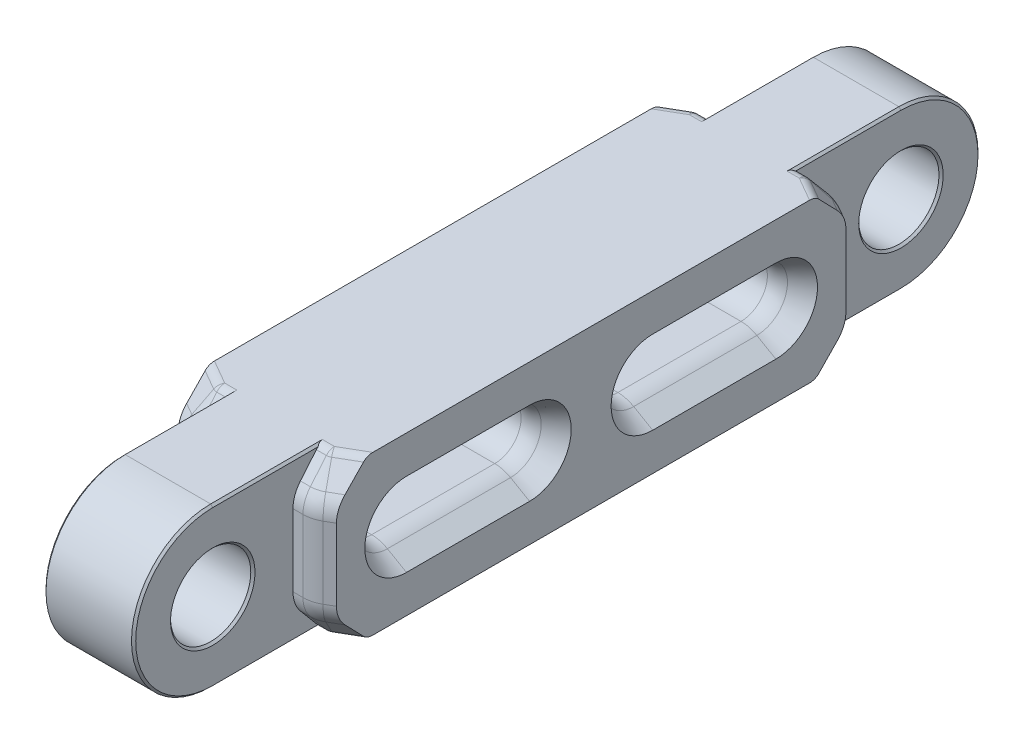
from build123d import *
from OCP.BRepFilletAPI import BRepFilletAPI_MakeChamfer

# Parameters (mm, degrees)
BOSS_EXTRUDE1_DEPTH = 8.5
BOSS_EXTRUDE2_DEPTH = 15
CHAMFER8_SIZE       = 3
CHAMFER8_SIZE2      = 1.732050808
FILLET6_R           = 6
CHAMFER9_SIZE       = 6
CHAMFER9_SIZE2      = 5.034597787
FILLET7_R           = 6
CHAMFER10_SIZE      = 5
CHAMFER10_SIZE2     = 2.886751346
FILLET8_R           = 6
FILLET9_R           = 2
CHAMFER11_SIZE      = 0.4


with BuildPart() as part:
    # Sketch1 → Boss-Extrude1 (new body)
    with BuildSketch(Plane.YZ):
        with BuildLine():
            ThreePointArc((0, -7.6), (-7.6, 0), (0, 7.6))
            Line((0, 7.6), (0, 15))
            ThreePointArc((0, 15), (-10.606601718, 10.606601718), (-15, 0))
            Line((-15, 0), (-15, -65.2))
            Line((-15, -65.2), (0, -65.2))
            Line((0, -65.2), (0, -58.533333333))
            ThreePointArc((0, -58.533333333), (-3.535533906, -57.068867239), (-5, -53.533333333))
            Line((-5, -53.533333333), (-5, -30.2))
            ThreePointArc((-5, -30.2), (-3.535533906, -26.664466094), (0, -25.2))
            Line((0, -25.2), (0, -7.6))
        make_face()
    extrude(amount=BOSS_EXTRUDE1_DEPTH)

    # Sketch1<4> → Boss-Extrude2 (add)
    with BuildSketch(Plane.YZ):
        with BuildLine():
            Line((0, -15.2), (-15, -15.2))
            Line((-15, -15.2), (-15, -65.2))
            Line((-15, -65.2), (0, -65.2))
            Line((0, -65.2), (0, -58.533333333))
            ThreePointArc((0, -58.533333333), (-3.535533906, -57.068867239), (-5, -53.533333333))
            Line((-5, -53.533333333), (-5, -30.2))
            ThreePointArc((-5, -30.2), (-3.535533906, -26.664466094), (0, -25.2))
            Line((0, -25.2), (0, -15.2))
        make_face()
    extrude(amount=BOSS_EXTRUDE2_DEPTH)

    # Chamfer8
    chamfer8_edges = [part.edges().sort_by_distance(p)[0] for p in [
        (15, -7.5, -15.2),
    ]]
    chamfer8_side = [part.faces().sort_by_distance(p)[0] for p in [
        (11.75, -7.5, -15.2),
    ]]
    chamfer(chamfer8_edges, length=CHAMFER8_SIZE, length2=CHAMFER8_SIZE2, reference=chamfer8_side[0])

    # Fillet6
    fillet6_edges = [part.edges().sort_by_distance(p)[0] for p in [
        (12, -7.5, -15.2),
    ]]
    fillet(fillet6_edges, radius=FILLET6_R)

    # Chamfer9: one chamfer whose edges measure the first distance from different faces: ONE call of the kernel's chamfer builder (chamfer() names one face for all edges)
    chamfer9_edges_1 = [part.edges().sort_by_distance(p)[0] for p in [
        (14.196152423, -15, -16.467949192),
    ]]
    chamfer9_side_1 = [part.faces().sort_by_distance(p)[0] for p in [
        (14.196152423, -7.5, -16.467949192),
    ]]
    chamfer9_edges_2 = [part.edges().sort_by_distance(p)[0] for p in [
        (11.945219116, -15, -15.404445042),
    ]]
    chamfer9_side_2 = [part.faces().sort_by_distance(p)[0] for p in [
        (11.945219116, -7.5, -15.404445042),
    ]]
    chamfer9_edges_3 = [part.edges().sort_by_distance(p)[0] for p in [
        (9.446152423, -15, -15.2),
    ]]
    chamfer9_side_3 = [part.faces().sort_by_distance(p)[0] for p in [
        (9.446152423, -7.5, -15.2),
    ]]
    chamfer9 = BRepFilletAPI_MakeChamfer(part.part.solid().wrapped)
    for e in chamfer9_edges_1:
        chamfer9.Add(CHAMFER9_SIZE, CHAMFER9_SIZE2, e.wrapped, chamfer9_side_1[0].wrapped)  # the first distance lies on this face
    for e in chamfer9_edges_2:
        chamfer9.Add(CHAMFER9_SIZE, CHAMFER9_SIZE2, e.wrapped, chamfer9_side_2[0].wrapped)  # the first distance lies on this face
    for e in chamfer9_edges_3:
        chamfer9.Add(CHAMFER9_SIZE, CHAMFER9_SIZE2, e.wrapped, chamfer9_side_3[0].wrapped)  # the first distance lies on this face
    add(Compound.cast(chamfer9.Shape()), mode=Mode.REPLACE)

    # Fillet7
    fillet7_edges = [part.edges().sort_by_distance(p)[0] for p in [
        (14.196152423, -9, -16.467949192),
        (11.945219116, -9, -15.404445042),
        (9.446152423, -9, -15.2),
    ]]
    fillet(fillet7_edges, radius=FILLET7_R)

    # Chamfer10: one chamfer whose edges measure the first distance from different faces: ONE call of the kernel's chamfer builder (chamfer() names one face for all edges)
    chamfer10_edges_1 = [part.edges().sort_by_distance(p)[0] for p in [
        (15, -3.535533906, -57.068867239),
    ]]
    chamfer10_side_1 = [part.faces().sort_by_distance(p)[0] for p in [
        (7.5, -3.535533906, -57.068867239),
    ]]
    chamfer10_edges_2 = [part.edges().sort_by_distance(p)[0] for p in [
        (15, -5, -41.866666667),
    ]]
    chamfer10_side_2 = [part.faces().sort_by_distance(p)[0] for p in [
        (7.5, -5, -41.866666667),
    ]]
    chamfer10_edges_3 = [part.edges().sort_by_distance(p)[0] for p in [
        (15, -3.535533906, -26.664466094),
    ]]
    chamfer10_side_3 = [part.faces().sort_by_distance(p)[0] for p in [
        (7.5, -3.535533906, -26.664466094),
    ]]
    chamfer10 = BRepFilletAPI_MakeChamfer(part.part.solid().wrapped)
    for e in chamfer10_edges_1:
        chamfer10.Add(CHAMFER10_SIZE, CHAMFER10_SIZE2, e.wrapped, chamfer10_side_1[0].wrapped)  # the first distance lies on this face
    for e in chamfer10_edges_2:
        chamfer10.Add(CHAMFER10_SIZE, CHAMFER10_SIZE2, e.wrapped, chamfer10_side_2[0].wrapped)  # the first distance lies on this face
    for e in chamfer10_edges_3:
        chamfer10.Add(CHAMFER10_SIZE, CHAMFER10_SIZE2, e.wrapped, chamfer10_side_3[0].wrapped)  # the first distance lies on this face
    add(Compound.cast(chamfer10.Shape()), mode=Mode.REPLACE)

    # Fillet8
    fillet8_edges = [part.edges().sort_by_distance(p)[0] for p in [
        (10, -3.535533906, -57.068867239),
        (10, -5, -41.866666667),
        (10, -3.535533906, -26.664466094),
    ]]
    fillet(fillet8_edges, radius=FILLET8_R)

    # Fillet9
    fillet9_edges = [part.edges().sort_by_distance(p)[0] for p in [
        (9.446152423, -15, -20.234597787),
        (10.642169324, -15, -20.26749307),
        (12.937502976, -15, -21.554720371),
    ]]
    fillet(fillet9_edges, radius=FILLET9_R)

    # Chamfer11
    chamfer11_edges = [part.edges().sort_by_distance(p)[0] for p in [
        (8.5, -7.6, 0),
        (8.5, -15, -10.583606552),
        (8.5, -10.606601718, 10.606601718),
    ]]
    chamfer(chamfer11_edges, length=CHAMFER11_SIZE)

    # Mirror1: part across plane


with BuildPart() as part_1:
    add(part.part)
    add(part.part.mirror(Plane(origin=(8.5, 0, 0), x_dir=(0, 0, 1), z_dir=(0, 1, 0))))

    # Mirror2: part across plane


with BuildPart() as part_2:
    add(part_1.part)
    add(part_1.part.mirror(Plane(origin=(8.5, 0, -65.2), x_dir=(1, 0, 0), z_dir=(0, 0, 1))))

    # Mirror3: part across plane


with BuildPart() as part_3:
    add(part_2.part)
    add(part_2.part.mirror(Plane(origin=(0, 0, 0), x_dir=(0, 0, 1), z_dir=(1, 0, 0))))


solid = part_3.part
